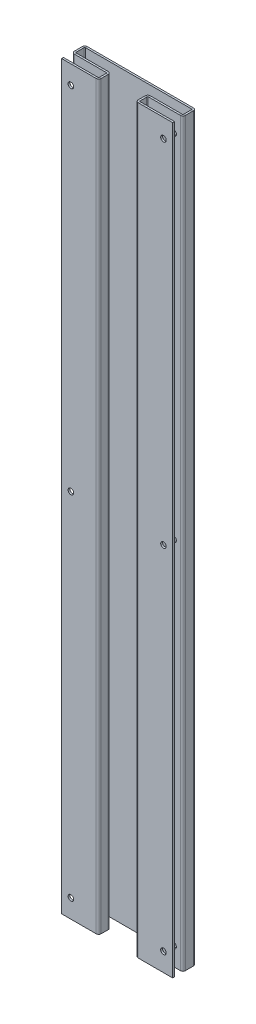
from build123d import *

# Parameters (mm, degrees)
SKETCH1_W                    = 40
SKETCH1_H                    = 800
BASE_FLANGE1_DEPTH           = 2
EDGE_FLANGE1_STRIP_W         = 9.4732
EDGE_FLANGE1_STRIP_H         = 2
EDGE_FLANGE1_STRIP_CUT_DEPTH = 800
EDGE_FLANGE1_DEPTH           = 800
EDGE_FLANGE2_STRIP_W         = 9.4732
EDGE_FLANGE2_STRIP_H         = 2
EDGE_FLANGE2_STRIP_CUT_DEPTH = 800
EDGE_FLANGE2_DEPTH           = 800
EDGE_FLANGE3_STRIP_W         = 9.4732
EDGE_FLANGE3_STRIP_H         = 2
EDGE_FLANGE3_STRIP_CUT_DEPTH = 800
EDGE_FLANGE3_DEPTH           = 800
EDGE_FLANGE4_STRIP_W         = 9.4732
EDGE_FLANGE4_STRIP_H         = 2
EDGE_FLANGE4_STRIP_CUT_DEPTH = 800
EDGE_FLANGE4_DEPTH           = 800
SKETCH20_R                   = 3
CUT_EXTRUDE1_DEPTH           = 414.067791046


# Sheet-metal steps are written as plain solids
with BuildPart() as part:
    # Sketch1 → Base-Flange1 (new body)
    with BuildSketch(Plane.XY):
        Rectangle(SKETCH1_W, SKETCH1_H)
    extrude(amount=-BASE_FLANGE1_DEPTH)

    # Edge-Flange1 strip (across the edge) → Edge-Flange1 strip cut (cut)
    with BuildSketch(Plane(origin=(20, 400, -2), x_dir=(-1, 0, 0), z_dir=(0, -1, 0))):
        with Locations((-2, -1)):
            Rectangle(EDGE_FLANGE1_STRIP_W, EDGE_FLANGE1_STRIP_H)
    extrude(amount=EDGE_FLANGE1_STRIP_CUT_DEPTH, mode=Mode.SUBTRACT)

    # Edge-Flange1 section (across the edge) → Edge-Flange1 (add)
    with BuildSketch(Plane(origin=(20, 400, -2), x_dir=(-1, 0, 0), z_dir=(0, -1, 0))):
        with BuildLine():
            Line((0, 0.7366), (0, 11))
            Line((0, 11), (2, 11))
            Line((2, 11), (2, 0.7366))
            ThreePointArc((2, 0.7366), (2.215745145, 0.215745145), (2.7366, 0))
            Line((2.7366, 0), (2.7366, -2))
            ThreePointArc((2.7366, -2), (0.801531583, -1.198468417), (0, 0.7366))
        make_face()
    extrude(amount=EDGE_FLANGE1_DEPTH)

    # Edge-Flange2 strip (across the edge) → Edge-Flange2 strip cut (cut)
    with BuildSketch(Plane(origin=(18, 400, -13), x_dir=(0, 0, 1), z_dir=(0, -1, 0))):
        with Locations((-2, -1)):
            Rectangle(EDGE_FLANGE2_STRIP_W, EDGE_FLANGE2_STRIP_H)
    extrude(amount=EDGE_FLANGE2_STRIP_CUT_DEPTH, mode=Mode.SUBTRACT)

    # Edge-Flange2 section (across the edge) → Edge-Flange2 (add)
    with BuildSketch(Plane(origin=(18, 400, -13), x_dir=(0, 0, 1), z_dir=(0, -1, 0))):
        with BuildLine():
            Line((0, 0.7366), (0, 38))
            Line((0, 38), (2, 38))
            Line((2, 38), (2, 0.7366))
            ThreePointArc((2, 0.7366), (2.215745145, 0.215745145), (2.7366, 0))
            Line((2.7366, 0), (2.7366, -2))
            ThreePointArc((2.7366, -2), (0.801531583, -1.198468417), (0, 0.7366))
        make_face()
    extrude(amount=EDGE_FLANGE2_DEPTH)

    # Edge-Flange3 strip (across the edge) → Edge-Flange3 strip cut (cut)
    with BuildSketch(Plane(origin=(-20, -400, -13), x_dir=(1, 0, 0), z_dir=(0, 1, 0))):
        with Locations((-2, -1)):
            Rectangle(EDGE_FLANGE3_STRIP_W, EDGE_FLANGE3_STRIP_H)
    extrude(amount=EDGE_FLANGE3_STRIP_CUT_DEPTH, mode=Mode.SUBTRACT)

    # Edge-Flange3 section (across the edge) → Edge-Flange3 (add)
    with BuildSketch(Plane(origin=(-20, -400, -13), x_dir=(1, 0, 0), z_dir=(0, 1, 0))):
        with BuildLine():
            Line((0, 0.7366), (0, 12))
            Line((0, 12), (2, 12))
            Line((2, 12), (2, 0.7366))
            ThreePointArc((2, 0.7366), (2.215745145, 0.215745145), (2.7366, 0))
            Line((2.7366, 0), (2.7366, -2))
            ThreePointArc((2.7366, -2), (0.801531583, -1.198468417), (0, 0.7366))
        make_face()
    extrude(amount=EDGE_FLANGE3_DEPTH)

    # Edge-Flange4 strip (across the edge) → Edge-Flange4 strip cut (cut)
    with BuildSketch(Plane(origin=(-18, -400, -25), x_dir=(0, 0, 1), z_dir=(0, 1, 0))):
        with Locations((-2, -1)):
            Rectangle(EDGE_FLANGE4_STRIP_W, EDGE_FLANGE4_STRIP_H)
    extrude(amount=EDGE_FLANGE4_STRIP_CUT_DEPTH, mode=Mode.SUBTRACT)

    # Edge-Flange4 section (across the edge) → Edge-Flange4 (add)
    with BuildSketch(Plane(origin=(-18, -400, -25), x_dir=(0, 0, 1), z_dir=(0, 1, 0))):
        with BuildLine():
            Line((0, 0.7366), (0, 58))
            Line((0, 58), (2, 58))
            Line((2, 58), (2, 0.7366))
            ThreePointArc((2, 0.7366), (2.215745145, 0.215745145), (2.7366, 0))
            Line((2.7366, 0), (2.7366, -2))
            ThreePointArc((2.7366, -2), (0.801531583, -1.198468417), (0, 0.7366))
        make_face()
    extrude(amount=EDGE_FLANGE4_DEPTH)

    # Mirror2: part across plane


with BuildPart() as part_1:
    add(part.part)
    add(part.part.mirror(Plane(origin=(40, -400, -25), x_dir=(0, 0, 1), z_dir=(-1, 0, 0))))

    # Sketch20 → Cut-Extrude1 (cut, through all)
    with BuildSketch(Plane.XY):
        with Locations((90, 0)):
            Circle(SKETCH20_R)
        with Locations((90, 380)):
            Circle(SKETCH20_R)
        with Locations((90, -380)):
            Circle(SKETCH20_R)
        with Locations((-10, -380)):
            Circle(SKETCH20_R)
        with Locations((-10, 0)):
            Circle(SKETCH20_R)
        with Locations((-10, 380)):
            Circle(SKETCH20_R)
    extrude(amount=-CUT_EXTRUDE1_DEPTH, mode=Mode.SUBTRACT)


solid = part_1.part
